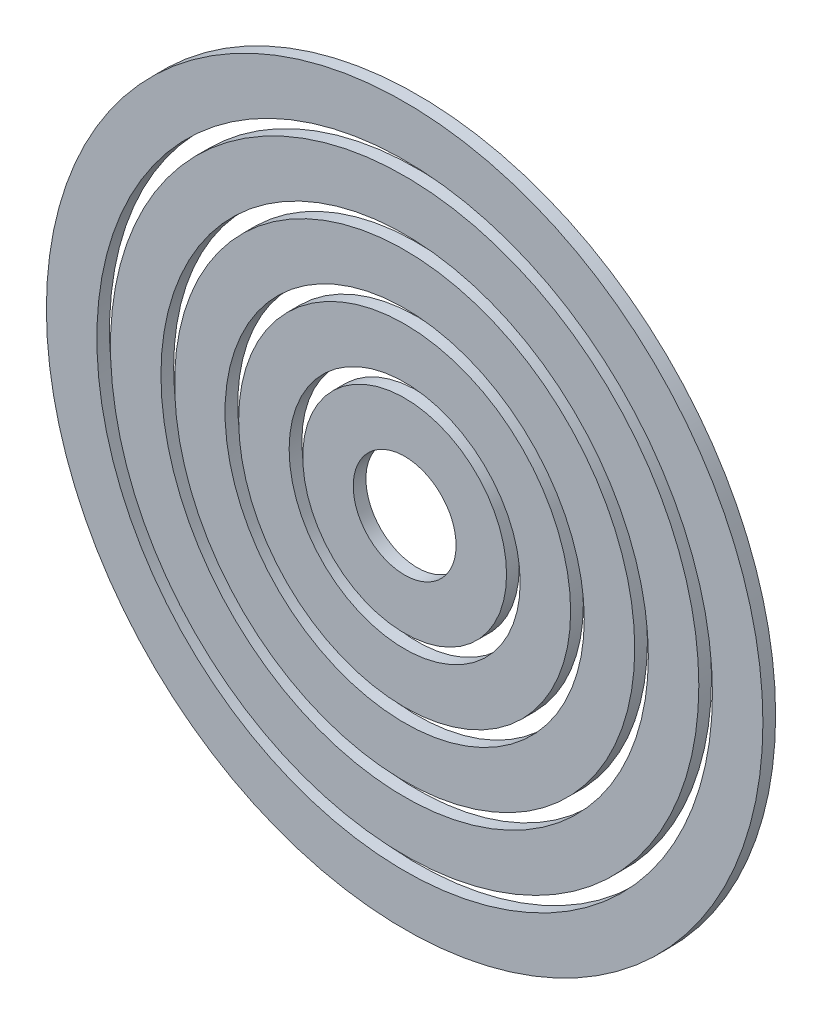
from build123d import *

# Parameters (mm, degrees)
SKETCH1_R             = 15.9
SKETCH1_R_2           = 8.026
BOSS_EXTRUDE1_DEPTH   = 1.9812
SKETCH1_R_3           = 25.9
SKETCH1_R_4           = 18.026
BOSS_EXTRUDE1_2_DEPTH = 1.9812
SKETCH1_R_5           = 35.9
SKETCH1_R_6           = 28.026
BOSS_EXTRUDE1_3_DEPTH = 1.9812
SKETCH1_R_7           = 45.9
SKETCH1_R_8           = 38.026
BOSS_EXTRUDE1_4_DEPTH = 1.9812
SKETCH1_R_9           = 55.9
SKETCH1_R_10          = 48.026
BOSS_EXTRUDE1_5_DEPTH = 1.9812


with BuildPart() as part:
    # Sketch1 → Boss-Extrude1 (new body)
    with BuildSketch(Plane.XY):
        Circle(SKETCH1_R)
        Circle(SKETCH1_R_2, mode=Mode.SUBTRACT)
    extrude(amount=BOSS_EXTRUDE1_DEPTH)


with BuildPart() as body_2:
    # Sketch1 → Boss-Extrude1 2 (new body)
    with BuildSketch(Plane.XY):
        Circle(SKETCH1_R_3)
        Circle(SKETCH1_R_4, mode=Mode.SUBTRACT)
    extrude(amount=BOSS_EXTRUDE1_2_DEPTH)


with BuildPart() as body_3:
    # Sketch1 → Boss-Extrude1 3 (new body)
    with BuildSketch(Plane.XY):
        Circle(SKETCH1_R_5)
        Circle(SKETCH1_R_6, mode=Mode.SUBTRACT)
    extrude(amount=BOSS_EXTRUDE1_3_DEPTH)


with BuildPart() as body_4:
    # Sketch1 → Boss-Extrude1 4 (new body)
    with BuildSketch(Plane.XY):
        Circle(SKETCH1_R_7)
        Circle(SKETCH1_R_8, mode=Mode.SUBTRACT)
    extrude(amount=BOSS_EXTRUDE1_4_DEPTH)


with BuildPart() as body_5:
    # Sketch1 → Boss-Extrude1 5 (new body)
    with BuildSketch(Plane.XY):
        Circle(SKETCH1_R_9)
        Circle(SKETCH1_R_10, mode=Mode.SUBTRACT)
    extrude(amount=BOSS_EXTRUDE1_5_DEPTH)


solid = Compound([part.part, body_2.part, body_3.part, body_4.part, body_5.part])
